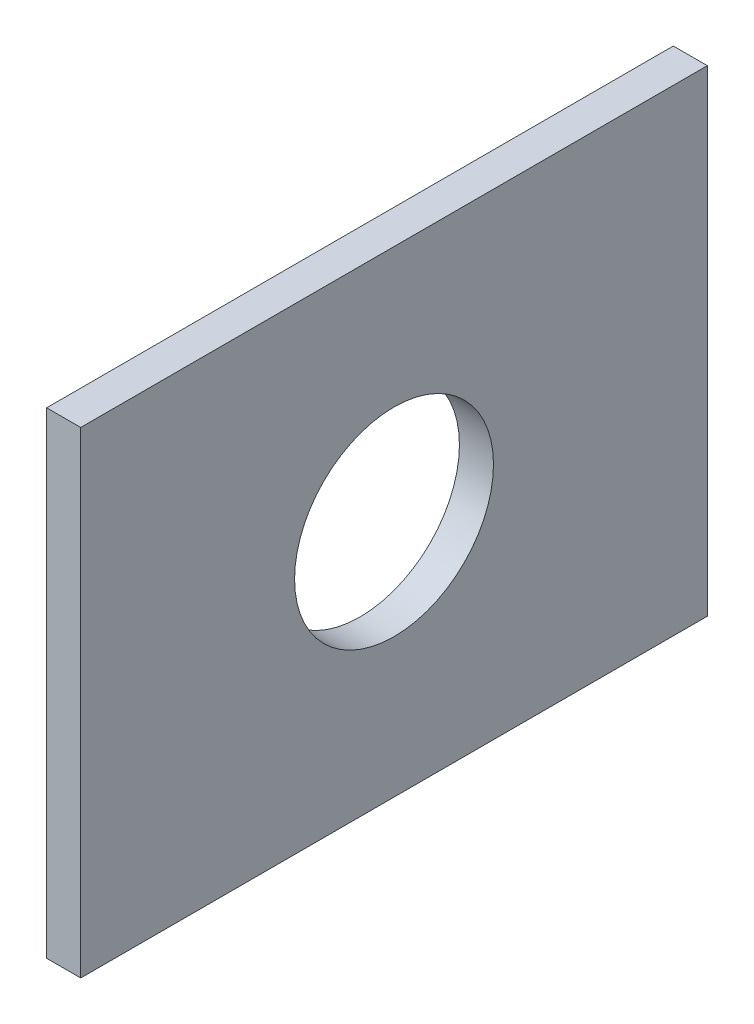
from build123d import *

# Parameters (mm, degrees)
SKETCH1_W           = 92
SKETCH1_H           = 70
SKETCH1_R           = 14.6
BOSS_EXTRUDE1_DEPTH = 5


with BuildPart() as part:
    # Sketch1 → Boss-Extrude1 (new body)
    with BuildSketch(Plane(origin=(0, 0, 0), x_dir=(0, 0, -1), z_dir=(1, 0, 0))):
        with Locations((46, -35)):
            Rectangle(SKETCH1_W, SKETCH1_H)
        with Locations((46, -35)):
            Circle(SKETCH1_R, mode=Mode.SUBTRACT)
    extrude(amount=BOSS_EXTRUDE1_DEPTH)


solid = part.part
